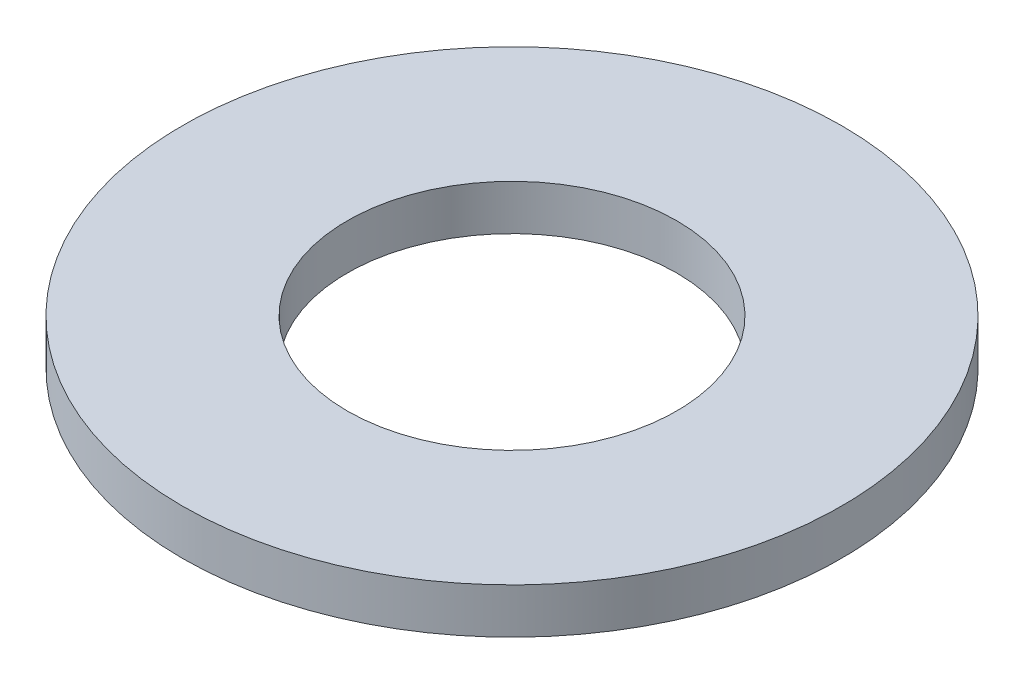
from build123d import *

# Parameters (mm, degrees)
SKETCH1_R           = 80
BOSS_EXTRUDE1_DEPTH = 11
SKETCH2_R           = 40
CUT_EXTRUDE1_DEPTH  = 114.670576668


with BuildPart() as part:
    # Sketch1 → Boss-Extrude1 (new body)
    with BuildSketch(Plane(origin=(0, 0, 0), x_dir=(1, 0, 0), z_dir=(0, 1, 0))):
        Circle(SKETCH1_R)
    extrude(amount=BOSS_EXTRUDE1_DEPTH)

    # Sketch2 → Cut-Extrude1 (cut, through all)
    with BuildSketch(Plane(origin=(0, 0, 0), x_dir=(1, 0, 0), z_dir=(0, 1, 0))):
        Circle(SKETCH2_R)
    extrude(amount=CUT_EXTRUDE1_DEPTH, mode=Mode.SUBTRACT)


solid = part.part
